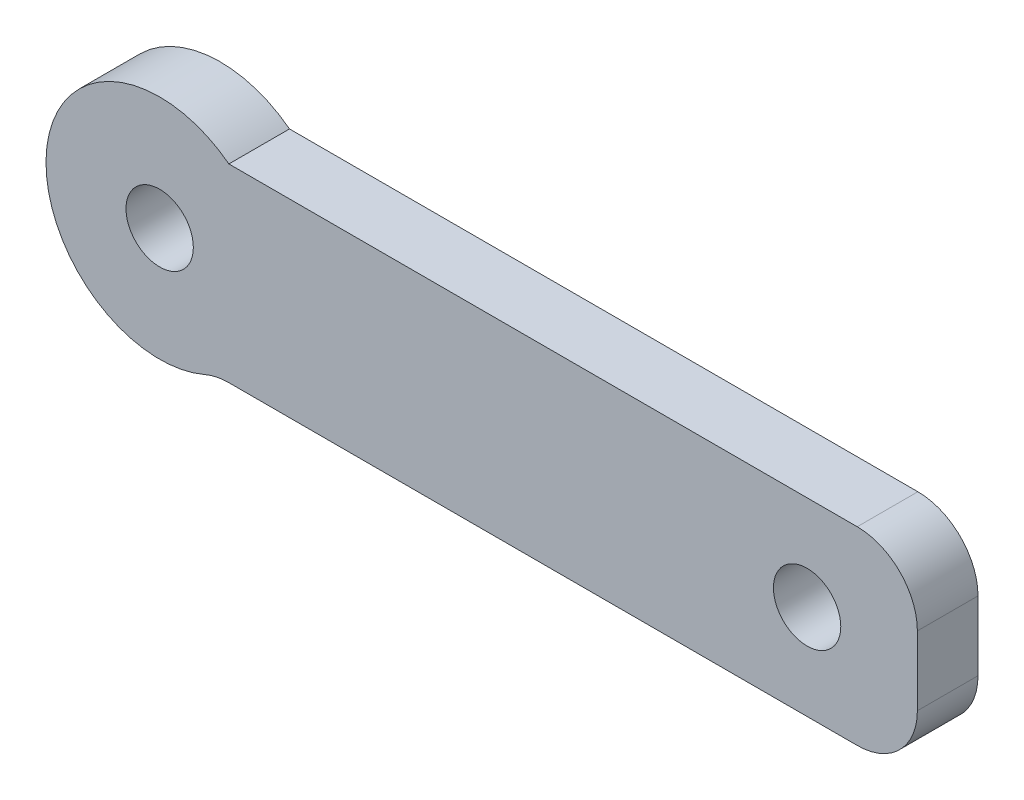
from build123d import *

# Parameters (mm, degrees)
BOSS_EXTRUDE1_DEPTH   = 1.6002
F_0_CLEARANCE_HOLE1_D = 1.778


with BuildPart() as part:
    # Sketch1 → Boss-Extrude1 (new body)
    with BuildSketch(Plane.XY):
        with BuildLine():
            Line((1.827005239, -2.620493359), (18.4125, -2.620493359))
            ThreePointArc((18.4125, -2.620493359), (19.535032015, -2.155525374), (20, -1.032993359))
            Line((20, -1.032993359), (20, 0.792006641))
            ThreePointArc((20, 0.792006641), (19.535032015, 1.914538656), (18.4125, 2.379506641))
            Line((18.4125, 2.379506641), (1.827005239, 2.379506641))
            ThreePointArc((1.827005239, 2.379506641), (-2.977484791, 0.366857357), (1.194771818, -2.75182127))
            ThreePointArc((1.194771818, -2.75182127), (1.504140671, -2.653672053), (1.827005239, -2.620493359))
        make_face()
    extrude(amount=BOSS_EXTRUDE1_DEPTH)

    # #0 Clearance Hole1 (through all)
    with Locations(Plane.XY.offset(1.6002)):
        with Locations((0, 0), (17.089319347, -0.120493359)):
            Hole(F_0_CLEARANCE_HOLE1_D / 2)


solid = part.part
